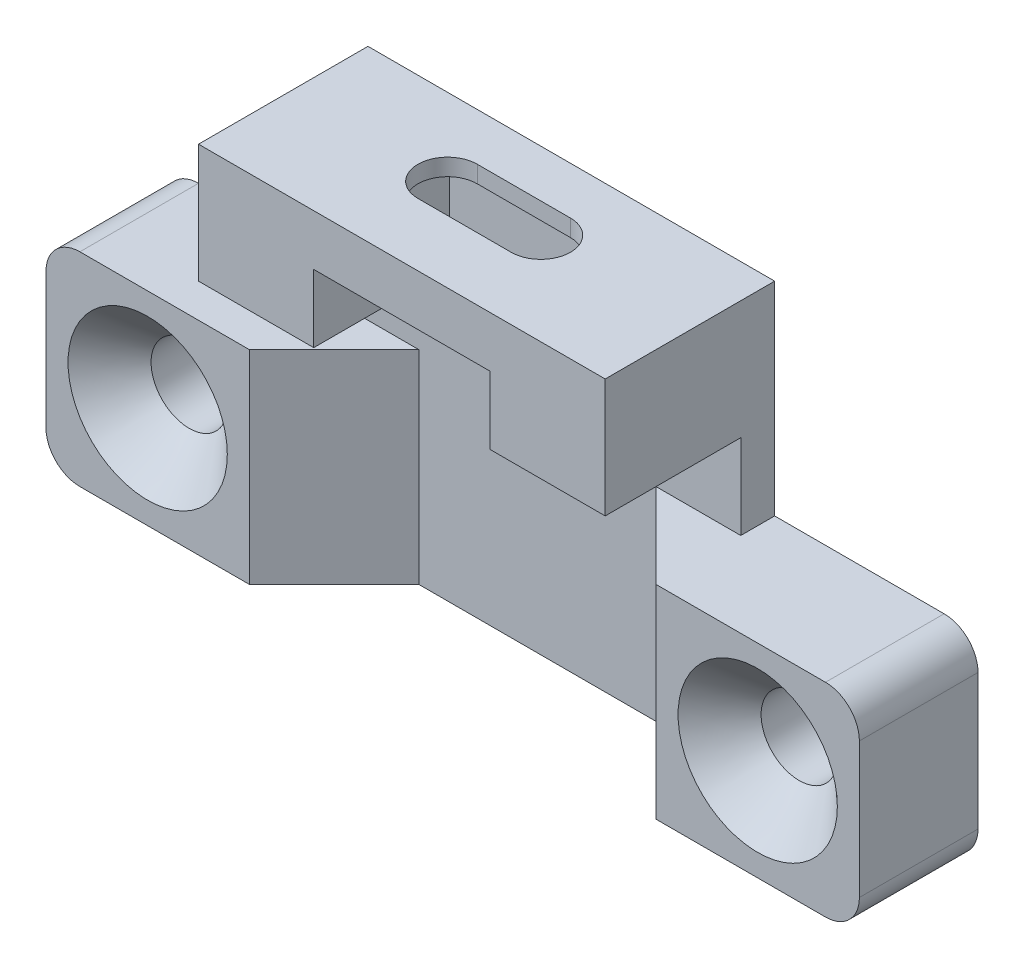
from build123d import *

# Parameters (mm, degrees)
AUFSATZ_LINEAR_AUSTRAGEN1_DEPTH                      = 10
SCHNITT_LINEAR_AUSTRAGEN1_DEPTH                      = 8
SCHNITT_LINEAR_AUSTRAGEN2_DEPTH                      = 6
SKIZZE4_W                                            = 12
SKIZZE4_H                                            = 12
AUFSATZ_LINEAR_AUSTRAGEN2_DEPTH                      = 5
FASE1_SIZE                                           = 5
FORMSENKUNG_F_R_M4_LINSENSENKSCHRAUBE_MI_D           = 4.5
FORMSENKUNG_F_R_M4_LINSENSENKSCHRAUBE_MI_CSINK_D     = 9.4
FORMSENKUNG_F_R_M4_LINSENSENKSCHRAUBE_MI_CSINK_ANGLE = 90
VERRUNDUNG1_R                                        = 2
SKIZZE8_W                                            = 10.4
SKIZZE8_H                                            = 2
AUFSATZ_LINEAR_AUSTRAGEN3_DEPTH                      = 1
FASE2_SIZE                                           = 2


with BuildPart() as part:
    # Skizze1 → Aufsatz-Linear austragen1 (new body)
    with BuildSketch(Plane.XY):
        Polygon((-12, 0), (12, 0), (12, -12), (24, -12), (24, -24), (-24, -24), (-24, -12), (-12, -12), align=None)
    extrude(amount=AUFSATZ_LINEAR_AUSTRAGEN1_DEPTH)

    # Skizze2 → Schnitt-Linear austragen1 (cut)
    with BuildSketch(Plane.XY.offset(10)):
        Polygon((-5.2, -1), (-5.2, -7), (-24, -7), (-24, -24), (24, -24), (24, -7), (5.2, -7), (5.2, -1), align=None)
    extrude(amount=-SCHNITT_LINEAR_AUSTRAGEN1_DEPTH, mode=Mode.SUBTRACT)

    # Skizze3 → Schnitt-Linear austragen2 (cut)
    with BuildSketch(Plane(origin=(0, 0, 0), x_dir=(1, 0, 0), z_dir=(0, 1, 0))):
        with BuildLine():
            Line((-2.75, -2.8), (2.75, -2.8))
            ThreePointArc((2.75, -2.8), (4.5, -4.55), (2.75, -6.3))
            Line((2.75, -6.3), (-2.75, -6.3))
            ThreePointArc((-2.75, -6.3), (-4.5, -4.55), (-2.75, -2.8))
        make_face()
    extrude(amount=-SCHNITT_LINEAR_AUSTRAGEN2_DEPTH, mode=Mode.SUBTRACT)

    # Skizze4 → Aufsatz-Linear austragen2 (add)
    with BuildSketch(Plane.XY.offset(2)):
        with Locations((-18, -18)):
            Rectangle(SKIZZE4_W, SKIZZE4_H)
        with Locations((18, -18)):
            Rectangle(SKIZZE4_W, SKIZZE4_H)
    extrude(amount=AUFSATZ_LINEAR_AUSTRAGEN2_DEPTH)

    # Fase1
    fase1_edges = [part.edges().sort_by_distance(p)[0] for p in [
        (12, -18, 2),
        (-12, -18, 2),
    ]]
    chamfer(fase1_edges, length=FASE1_SIZE - 0.0001)  # a hair under: the kernel refuses the full size

    # Formsenkung für M4 Linsensenkschraube mit Schlitz1 (through all)
    with Locations(Plane.XY.offset(7)):
        with Locations((-18, -18), (18, -18)):
            CounterSinkHole(FORMSENKUNG_F_R_M4_LINSENSENKSCHRAUBE_MI_D / 2, FORMSENKUNG_F_R_M4_LINSENSENKSCHRAUBE_MI_CSINK_D / 2, counter_sink_angle=FORMSENKUNG_F_R_M4_LINSENSENKSCHRAUBE_MI_CSINK_ANGLE)

    # Verrundung1
    verrundung1_edges = [part.edges().sort_by_distance(p)[0] for p in [
        (24, -12, 3.5),
        (24, -24, 3.5),
        (-24, -24, 3.5),
        (-24, -12, 3.5),
    ]]
    fillet(verrundung1_edges, radius=VERRUNDUNG1_R)

    # Skizze8 → Aufsatz-Linear austragen3 (add)
    with BuildSketch(Plane.XY.offset(10)):
        with Locations((0, -2)):
            Rectangle(SKIZZE8_W, SKIZZE8_H)
    extrude(amount=-AUFSATZ_LINEAR_AUSTRAGEN3_DEPTH)

    # Fase2
    fase2_edges = [part.edges().sort_by_distance(p)[0] for p in [
        (0, -1, 9),
    ]]
    chamfer(fase2_edges, length=FASE2_SIZE - 0.0001)  # a hair under: the kernel refuses the full size


solid = part.part
